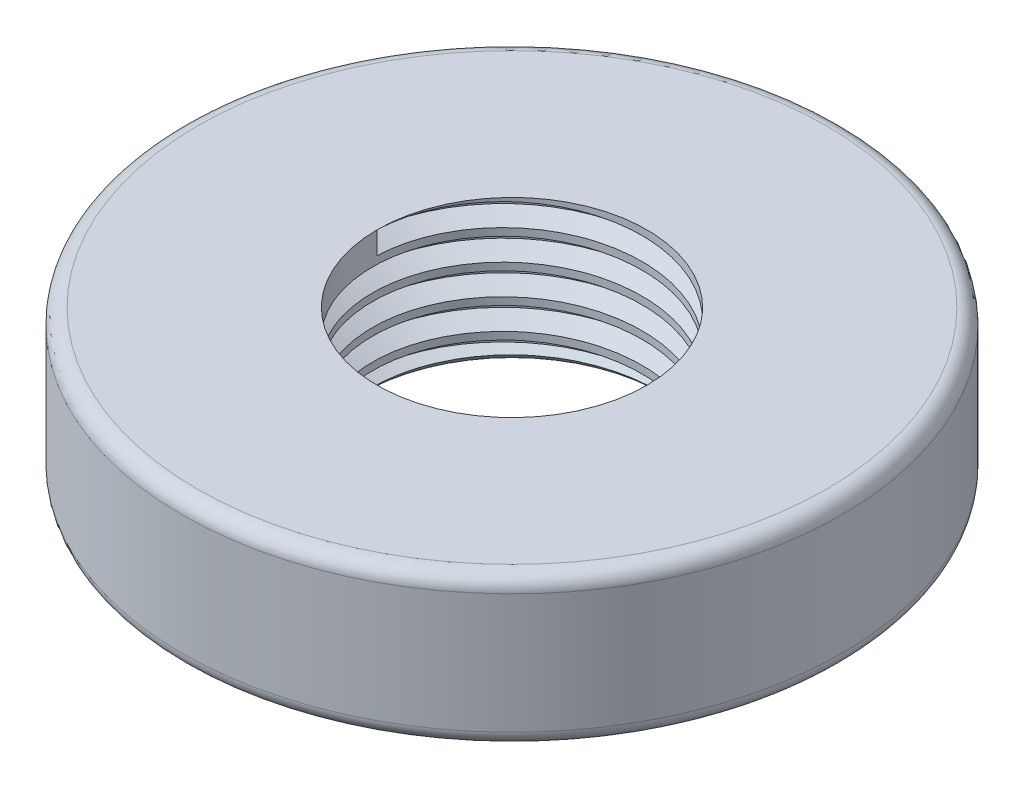
from build123d import *

# Parameters (mm, degrees)
ESBO_O1_R                = 11
RESSALTO_EXTRUS_O1_DEPTH = 5
FILETE1_R                = 0.5
ROSCA1_PITCH             = 1


with BuildPart() as part:
    # Esboço1 → Ressalto-extrusão1 (new body)
    with BuildSketch(Plane(origin=(0, 0, 0), x_dir=(1, 0, 0), z_dir=(0, 1, 0))):
        with Locations(Location((0, 0, 0), (0, 0, 270))):
            Circle(ESBO_O1_R)
    extrude(amount=RESSALTO_EXTRUS_O1_DEPTH)

    # Filete1
    filete1_edges = [part.edges().sort_by_distance(p)[0] for p in [
        (0, 0, -11),
        (0, 5, -11),
    ]]
    fillet(filete1_edges, radius=FILETE1_R)

    # Esboço4 → Furo roscado de M10x1.01 (revolve, cut)
    with BuildSketch(Plane(origin=(0, 0, 0), x_dir=(0, 0, -1), z_dir=(1, 0, 0))):
        Polygon((0, 0), (0, 5), (4.5, 5), (4.5, 0.525), (5.025, 0), align=None)
    revolve(axis=Axis((0, -6.35, 0), (0, 1, 0)), mode=Mode.SUBTRACT)

    # Rosca1: the profile of Perfil da rosca1 profile screwed along a right-hand helix of 6 turns, 8 arcs to a turn; built about Z, then put on its axis
    rosca1_z = Axis((0, 0, 0), (0, 0, 1))
    rosca1_corners = [(4.4997, 0, -0.000173205), (5.041265875, 0, 0.312499999), (5.041265875, 0, 0.437499999), (4.4997, 0, 0.750173202)]
    with BuildLine(mode=Mode.PRIVATE) as rosca1_profile:
        Line(rosca1_corners[0], rosca1_corners[1])
        Line(rosca1_corners[1], rosca1_corners[2])
        Line(rosca1_corners[2], rosca1_corners[3])
        Line(rosca1_corners[3], rosca1_corners[0])
    rosca1_cap = Face(rosca1_profile.wire())
    rosca1_turn_angles = [0, 22.5, 45, 67.5, 90, 112.5, 135, 157.5, 180, 202.5, 225, 247.5, 270, 292.5, 315, 337.5, 360]
    rosca1_turn_weights = [1, 0.9238795325112867, 1, 0.9238795325112867, 1, 0.9238795325112867, 1, 0.9238795325112867, 1, 0.9238795325112867, 1, 0.9238795325112867, 1, 0.9238795325112867, 1, 0.9238795325112867, 1]
    rosca1_turn_rails = [Edge.make_bspline([Vector(p[0], p[1], 0).rotate(rosca1_z, rosca1_turn_angles[k]) / rosca1_turn_weights[k] + Vector(0, 0, p[2] + ROSCA1_PITCH * rosca1_turn_angles[k] / 360) for k in range(17)], [0, 0, 0, 1, 1, 2, 2, 3, 3, 4, 4, 5, 5, 6, 6, 7, 7, 8, 8, 8], 2, rosca1_turn_weights) for p in rosca1_corners]
    rosca1_turn_sides = [Face.make_surface_from_curves(rosca1_turn_rails[p[0]], rosca1_turn_rails[p[1]]) for p in [(0, 1), (1, 2), (2, 3), (3, 0)]]
    rosca1 = Plane(origin=(0, 5, 0), x_dir=(-1, 0, 0), z_dir=(0, -1, 0)) * Solid(Shell([*[p.moved(Location((0, 0, ROSCA1_PITCH * i))) for i in range(6) for p in rosca1_turn_sides], rosca1_cap, rosca1_cap.rotate(rosca1_z, 2160).moved(Location((0, 0, ROSCA1_PITCH * 2160 / 360)))]))
    add(rosca1, mode=Mode.SUBTRACT)


solid = part.part
